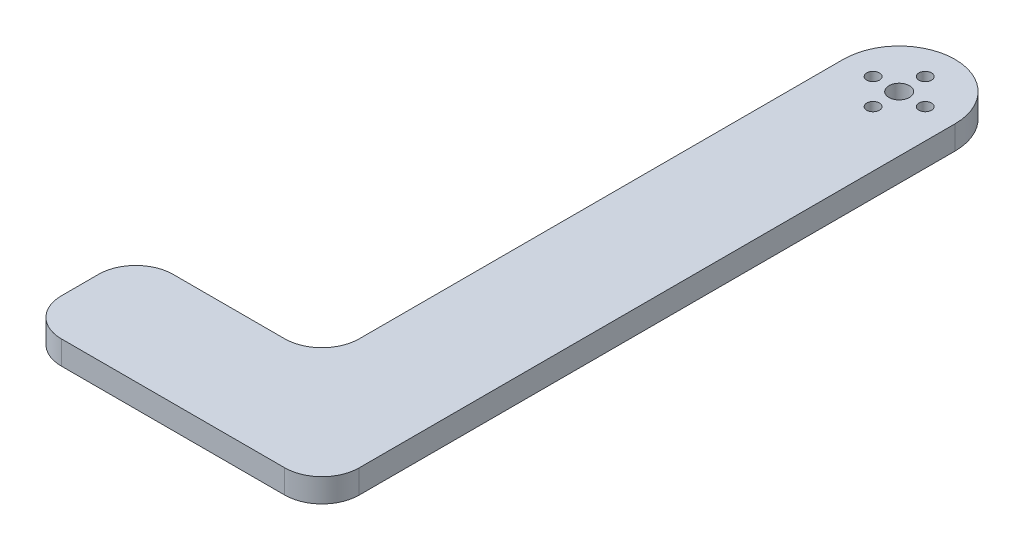
from build123d import *

# Parameters (mm, degrees)
BOSS_EXTRUDE1_DEPTH  = 6.35
M3_CLEARANCE_HOLE1_D = 3.4
CIRPATTERN1_COUNT    = 4
FILLET1_R            = 10
SKETCH5_R            = 2.75
CUT_EXTRUDE1_DEPTH   = 10


with BuildPart() as part:
    # Sketch2 → Boss-Extrude1 (new body)
    with BuildSketch(Plane(origin=(0, 0, 0), x_dir=(1, 0, 0), z_dir=(0, 1, 0))):
        with BuildLine():
            Line((15, -170), (15, 0))
            ThreePointArc((15, 0), (0, 15), (-15, 0))
            Line((-15, 0), (-15, -140))
            Line((-15, -140), (-65, -140))
            Line((-65, -140), (-65, -170))
            Line((-65, -170), (15, -170))
        make_face()
    extrude(amount=BOSS_EXTRUDE1_DEPTH)

    # M3 Clearance Hole1 (through all)
    with Locations(Plane(origin=(0, 6.35, 0), x_dir=(1, 0, 0), z_dir=(0, 1, 0))):
        with Locations((0, 7)):
            m3_clearance_hole1 = Hole(M3_CLEARANCE_HOLE1_D / 2)

    # CirPattern1: M3 Clearance Hole1 ×4 about axis
    cirpattern1_axis = Axis((0, 6.35, 0), (0, -1, 0))
    for i in range(1, CIRPATTERN1_COUNT):
        add(m3_clearance_hole1.rotate(cirpattern1_axis, i * 360 / CIRPATTERN1_COUNT), mode=Mode.SUBTRACT)

    # Fillet1
    fillet1_edges = [part.edges().sort_by_distance(p)[0] for p in [
        (15, 3.175, 170),
        (-65, 3.175, 170),
        (-65, 3.175, 140),
        (-15, 3.175, 140),
    ]]
    fillet(fillet1_edges, radius=FILLET1_R)

    # Sketch5 → Cut-Extrude1 (cut)
    with BuildSketch(Plane(origin=(0, 6.35, 0), x_dir=(1, 0, 0), z_dir=(0, 1, 0))):
        Circle(SKETCH5_R)
    extrude(amount=-CUT_EXTRUDE1_DEPTH, mode=Mode.SUBTRACT)


solid = part.part
